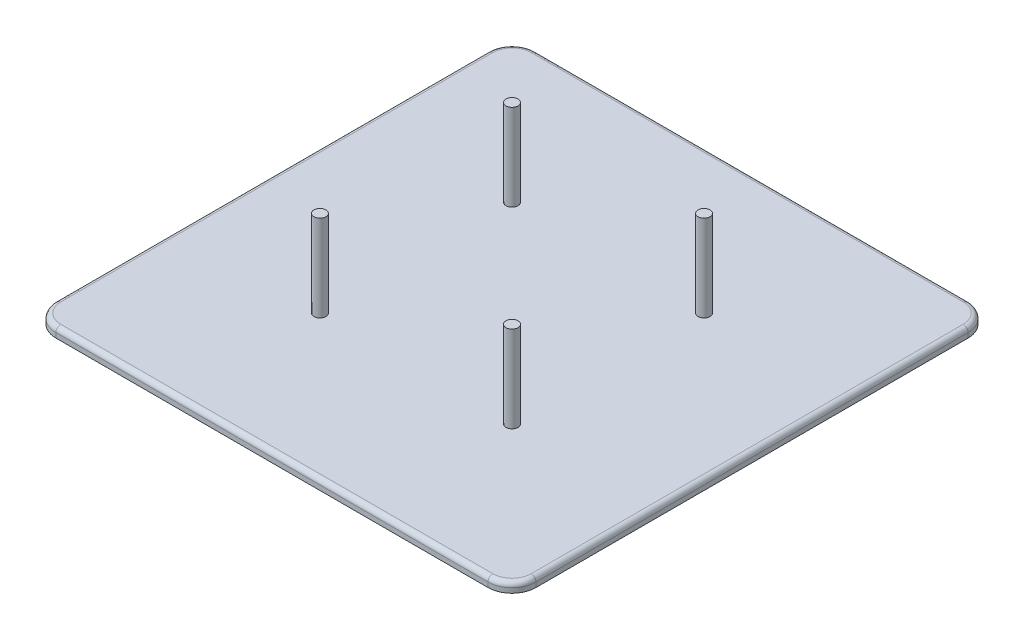
from build123d import *

# Parameters (mm, degrees)
SKETCH1_W           = 100
SKETCH1_H           = 100
BOSS_EXTRUDE1_DEPTH = 2
SKETCH2_R           = 1.25
BOSS_EXTRUDE2_DEPTH = 20
FILLET1_R           = 1
FILLET2_R           = 5


with BuildPart() as part:
    # Sketch1 → Boss-Extrude1 (new body)
    with BuildSketch(Plane(origin=(0, 0, 0), x_dir=(1, 0, 0), z_dir=(0, 1, 0))):
        Rectangle(SKETCH1_W, SKETCH1_H)
    extrude(amount=BOSS_EXTRUDE1_DEPTH)

    # Sketch2 → Boss-Extrude2 (add)
    with BuildSketch(Plane(origin=(0, 0, 0), x_dir=(1, 0, 0), z_dir=(0, 1, 0))):
        with Locations(Location((-20, -20, 0), (0, 0, 270))):
            Circle(SKETCH2_R)
        with Locations(Location((-20, 20, 0), (0, 0, 270))):
            Circle(SKETCH2_R)
        with Locations(Location((20, 20, 0), (0, 0, 270))):
            Circle(SKETCH2_R)
        with Locations(Location((20, -20, 0), (0, 0, 270))):
            Circle(SKETCH2_R)
    extrude(amount=BOSS_EXTRUDE2_DEPTH)

    # Fillet1
    fillet1_edges = [part.edges().sort_by_distance(p)[0] for p in [
        (-50, 2, 0),
        (0, 2, 50),
        (50, 2, 0),
        (0, 2, -50),
    ]]
    fillet(fillet1_edges, radius=FILLET1_R)

    # Fillet2
    # the kernel refuses this fillet: 5 mm, written as the material it takes off along each edge
    with BuildSketch(Plane(origin=(-45, 2, 45), x_dir=(-1, 0, 0), z_dir=(0, 0, -1))) as fillet2_piece_1:
        with BuildLine():
            CenterArc((4, -1), 1, 0, 90)
            Line((5, -1), (5, 0))
            Line((5, 0), (4, 0))
        make_face()
    revolve(axis=Axis((-45, 2, 45), (0, 1, 0)), revolution_arc=90, mode=Mode.SUBTRACT)
    with BuildSketch(Plane(origin=(-45, 2, -45), x_dir=(0, 0, -1), z_dir=(1, 0, 0))) as fillet2_piece_2:
        with BuildLine():
            CenterArc((4, -1), 1, 0, 90)
            Line((5, -1), (5, 0))
            Line((5, 0), (4, 0))
        make_face()
    revolve(axis=Axis((-45, 2, -45), (0, 1, 0)), revolution_arc=90, mode=Mode.SUBTRACT)
    with BuildSketch(Plane(origin=(45, 2, 45), x_dir=(0, 0, 1), z_dir=(-1, 0, 0))) as fillet2_piece_3:
        with BuildLine():
            CenterArc((4, -1), 1, 0, 90)
            Line((5, -1), (5, 0))
            Line((5, 0), (4, 0))
        make_face()
    revolve(axis=Axis((45, 2, 45), (0, 1, 0)), revolution_arc=90, mode=Mode.SUBTRACT)
    with BuildSketch(Plane(origin=(45, 2, -45), x_dir=(1, 0, 0), z_dir=(0, 0, 1))) as fillet2_piece_4:
        with BuildLine():
            CenterArc((4, -1), 1, 0, 90)
            Line((5, -1), (5, 0))
            Line((5, 0), (4, 0))
        make_face()
    revolve(axis=Axis((45, 2, -45), (0, 1, 0)), revolution_arc=90, mode=Mode.SUBTRACT)
    with BuildSketch(Plane(origin=(50, -12.5, -50), x_dir=(-1, 0, 0), z_dir=(0, 1, 0)), Plane(origin=(50, -12.5, 50), x_dir=(0, 0, -1), z_dir=(0, 1, 0))) as fillet2_piece_5:
        with BuildLine():
            CenterArc((FILLET2_R, FILLET2_R), FILLET2_R, 180, 90)
            Line((0, FILLET2_R), (0, 0))
            Line((0, 0), (FILLET2_R, 0))
        make_face()
    extrude(amount=14.5, mode=Mode.SUBTRACT)
    with BuildSketch(Plane(origin=(-50, -12.5, -50), x_dir=(1, 0, 0), z_dir=(0, 1, 0)), Plane(origin=(-50, -12.5, 50), x_dir=(0, 0, -1), z_dir=(0, 1, 0))) as fillet2_piece_6:
        with BuildLine():
            CenterArc((FILLET2_R, -FILLET2_R), FILLET2_R, 90, 90)
            Line((0, -FILLET2_R), (0, 0))
            Line((0, 0), (FILLET2_R, 0))
        make_face()
    extrude(amount=14.5, mode=Mode.SUBTRACT)


solid = part.part
